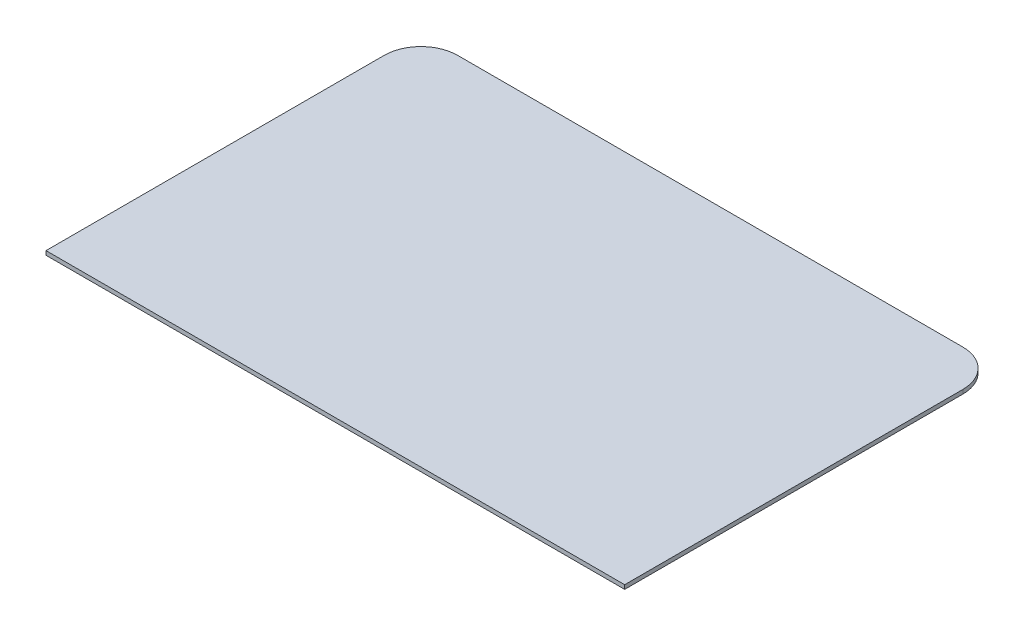
from build123d import *

# Parameters (mm, degrees)
SKETCH1_W           = 450.85
SKETCH1_H           = 292.1
BOSS_EXTRUDE1_DEPTH = 3.175
FILLET1_R           = 28.575


with BuildPart() as part:
    # Sketch1 → Boss-Extrude1 (new body)
    with BuildSketch(Plane(origin=(0, 0, 0), x_dir=(1, 0, 0), z_dir=(0, 1, 0))):
        Rectangle(SKETCH1_W, SKETCH1_H)
    extrude(amount=BOSS_EXTRUDE1_DEPTH)

    # Fillet1
    fillet1_edges = [part.edges().sort_by_distance(p)[0] for p in [
        (-225.425, 1.5875, -146.05),
        (225.425, 1.5875, -146.05),
    ]]
    fillet(fillet1_edges, radius=FILLET1_R)


solid = part.part
